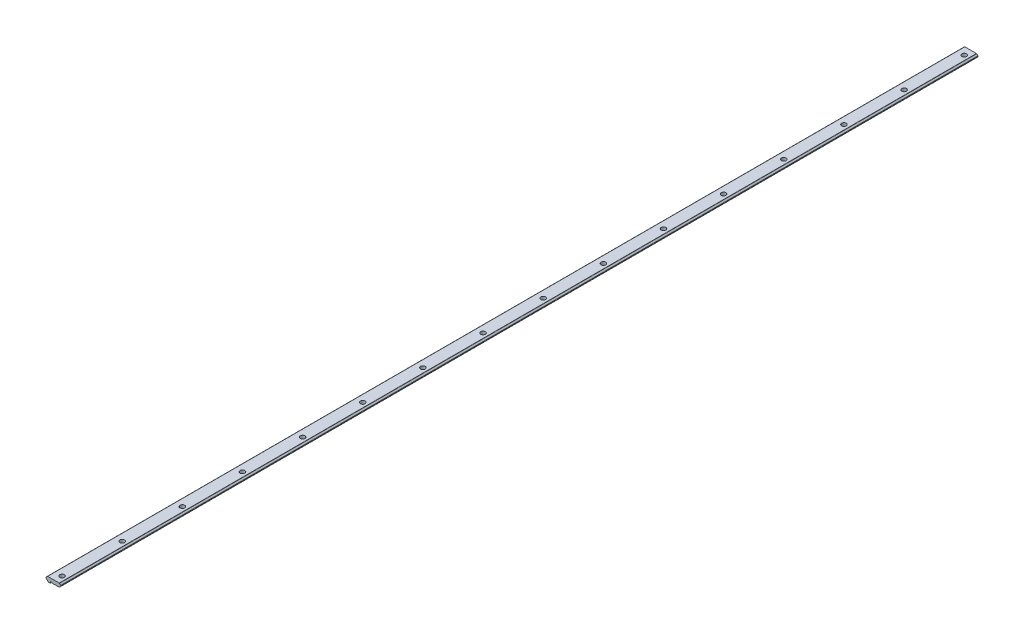
from build123d import *

# Parameters (mm, degrees)
BOSS_EXTRUDE1_START = -387.35
BOSS_EXTRUDE1_DEPTH = 774.7
SKETCH2_R           = 1.9812
CUT_EXTRUDE1_DEPTH  = 388.419680715
LPATTERN1_COUNT     = 16
LPATTERN1_PITCH     = 50.8


# Read off the part's stored shape, not the designer's step: Boss-Extrude1
with BuildPart() as part:
    # Boss-Extrude1 outline → Boss-Extrude1 (new body)
    with BuildSketch(Plane.XY.offset(BOSS_EXTRUDE1_START)):
        with BuildLine():
            ThreePointArc((-4.871384633, 1.524), (-5.01718702, 1.494998102), (-5.140792316, 1.412407684))
            Line((-5.140792316, 1.412407684), (-6.124107684, 0.429092316))
            ThreePointArc((-6.124107684, 0.429092316), (-6.206698102, 0.30548702), (-6.2357, 0.159684633))
            Line((-6.2357, 0.159684633), (-6.2357, -0.159684633))
            ThreePointArc((-6.2357, -0.159684633), (-6.206698102, -0.30548702), (-6.124107684, -0.429092316))
            Line((-6.124107684, -0.429092316), (-4.302592316, -2.250607684))
            ThreePointArc((-4.302592316, -2.250607684), (-4.17898702, -2.333198102), (-4.033184633, -2.3622))
            Line((-4.033184633, -2.3622), (-2.921, -2.3622))
            ThreePointArc((-2.921, -2.3622), (-2.651592316, -2.250607684), (-2.54, -1.9812))
            Line((-2.54, -1.9812), (-2.54, -1.27))
            ThreePointArc((-2.54, -1.27), (-2.311529276, -1.017286217), (-2.037131842, -1.2192))
            ThreePointArc((-2.037131842, -1.2192), (-1.904795163, -1.438121331), (-1.663829605, -1.524))
            Line((-1.663829605, -1.524), (4.871384633, -1.524))
            ThreePointArc((4.871384633, -1.524), (5.01718702, -1.494998102), (5.140792316, -1.412407684))
            Line((5.140792316, -1.412407684), (6.124107684, -0.429092316))
            ThreePointArc((6.124107684, -0.429092316), (6.206698102, -0.30548702), (6.2357, -0.159684633))
            Line((6.2357, -0.159684633), (6.2357, 0.159684633))
            ThreePointArc((6.2357, 0.159684633), (6.206698102, 0.30548702), (6.124107684, 0.429092316))
            Line((6.124107684, 0.429092316), (5.140792316, 1.412407684))
            ThreePointArc((5.140792316, 1.412407684), (5.01718702, 1.494998102), (4.871384633, 1.524))
            Line((4.871384633, 1.524), (-4.871384633, 1.524))
        make_face()
    extrude(amount=BOSS_EXTRUDE1_DEPTH)

    # Sketch2 → Cut-Extrude1 (cut, through all)
    with BuildSketch(Plane(origin=(0, 1.524, 0), x_dir=(1, 0, 0), z_dir=(0, 1, 0))):
        with Locations(Location((0.9652, -381, 0), (0, 0, 180))):
            Circle(SKETCH2_R)
    cut_extrude1 = extrude(amount=-CUT_EXTRUDE1_DEPTH, mode=Mode.SUBTRACT)

    # LPattern1: Cut-Extrude1 ×16
    with Locations(*[(0, 0, -i * LPATTERN1_PITCH) for i in range(1, LPATTERN1_COUNT)]):
        add(cut_extrude1, mode=Mode.SUBTRACT)


solid = part.part
